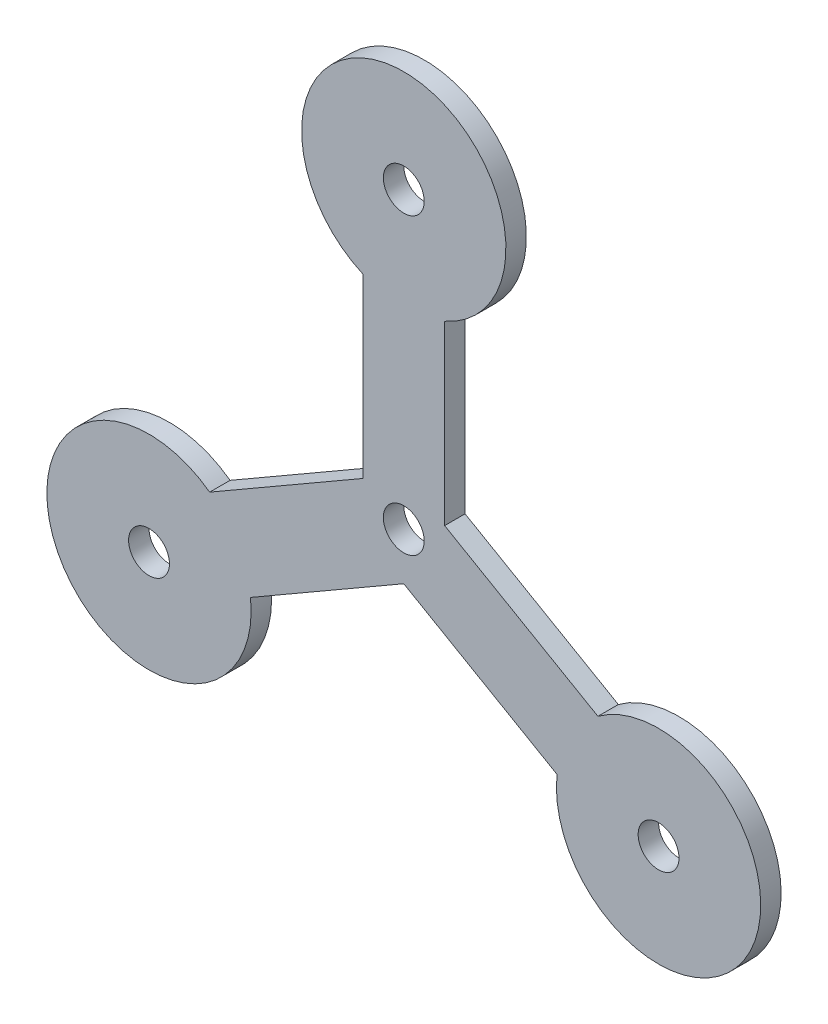
from build123d import *

# Parameters (mm, degrees)
BOSS_EXTRUDE2_DEPTH = 10
SKETCH3_R           = 50
BOSS_EXTRUDE3_DEPTH = 10
SKETCH4_R           = 10
BOSS_EXTRUDE4_DEPTH = 90
CUT_EXTRUDE1_START  = -30
SKETCH5_R           = 10
CUT_EXTRUDE1_DEPTH  = 30
SKETCH6_R           = 13
CUT_EXTRUDE2_DEPTH  = 10
SKETCH7_R           = 10
BOSS_EXTRUDE5_DEPTH = 30
SKETCH8_R           = 20.369169003
BOSS_EXTRUDE6_DEPTH = 10
CUT_EXTRUDE3_START  = -100
SKETCH9_R           = 10
CUT_EXTRUDE3_DEPTH  = 100
SKETCH10_R          = 10
CUT_EXTRUDE4_DEPTH  = 10


with BuildPart() as part:
    # Sketch1 → Boss-Extrude2 (new body)
    with BuildSketch(Plane.XY):
        Polygon((20, 144), (-20, 144), (-20, 11.547005384), (-134.707658145, -54.679491924), (-114.707658145, -89.320508076), (0, -23.094010768), (114.707658145, -89.320508076), (134.707658145, -54.679491924), (20, 11.547005384), align=None)
    extrude(amount=BOSS_EXTRUDE2_DEPTH)

    # Sketch3 → Boss-Extrude3 (add)
    with BuildSketch(Plane.XY.offset(10)):
        with Locations((-124.707658145, -72)):
            Circle(SKETCH3_R)
        with Locations((0, 144)):
            Circle(SKETCH3_R)
        with Locations((124.707658145, -72)):
            Circle(SKETCH3_R)
    extrude(amount=-BOSS_EXTRUDE3_DEPTH)

    # Sketch4 → Boss-Extrude4 (add)
    with BuildSketch(Plane.XY.offset(10)):
        with Locations((0, 144)):
            Circle(SKETCH4_R)
        with Locations((124.707658145, -72)):
            Circle(SKETCH4_R)
        with Locations((-124.707658145, -72)):
            Circle(SKETCH4_R)
    extrude(amount=BOSS_EXTRUDE4_DEPTH)

    # Sketch5 → Cut-Extrude1 (cut)
    with BuildSketch(Plane.XY.offset(100).offset(CUT_EXTRUDE1_START)):
        with Locations((0, 144)):
            Circle(SKETCH5_R)
    extrude(amount=CUT_EXTRUDE1_DEPTH, mode=Mode.SUBTRACT)

    # Sketch6 → Cut-Extrude2 (cut)
    with BuildSketch(Plane.XY.offset(10)):
        Circle(SKETCH6_R)
    extrude(amount=-CUT_EXTRUDE2_DEPTH, mode=Mode.SUBTRACT)

    # Sketch7 → Boss-Extrude5 (add)
    with BuildSketch(Plane.XY.offset(70)):
        with Locations((0, 144)):
            Circle(SKETCH7_R)
    extrude(amount=BOSS_EXTRUDE5_DEPTH)

    # Sketch8 → Boss-Extrude6 (add)
    with BuildSketch(Plane.XY.offset(10)):
        Circle(SKETCH8_R)
    extrude(amount=-BOSS_EXTRUDE6_DEPTH)

    # Sketch9 → Cut-Extrude3 (cut)
    with BuildSketch(Plane.XY.offset(100).offset(CUT_EXTRUDE3_START)):
        with Locations((-124.707658145, -72)):
            Circle(SKETCH9_R)
        with Locations((0, 144)):
            Circle(SKETCH9_R)
        with Locations((124.707658145, -72)):
            Circle(SKETCH9_R)
    extrude(amount=CUT_EXTRUDE3_DEPTH, mode=Mode.SUBTRACT)

    # Sketch10 → Cut-Extrude4 (cut)
    with BuildSketch(Plane.XY.offset(10)):
        Circle(SKETCH10_R)
    extrude(amount=-CUT_EXTRUDE4_DEPTH, mode=Mode.SUBTRACT)


solid = part.part
